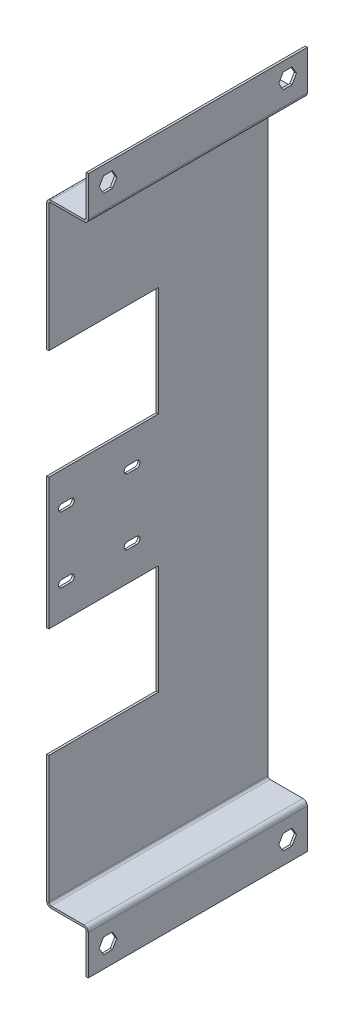
from build123d import *

# Parameters (mm, degrees)
SKETCH1_W                      = 280
SKETCH1_H                      = 100
BOSS_EXTRUDE1_DEPTH            = 1
SKETCH2_W                      = 50
SKETCH2_H                      = 50
CUT_EXTRUDE3_DEPTH             = 149.664050799
CUT_EXTRUDE4_DEPTH             = 149.664050799
EDGE_FLANGE1_STRIP_W           = 6
EDGE_FLANGE1_STRIP_H           = 1
EDGE_FLANGE1_STRIP_CUT_DEPTH   = 100
EDGE_FLANGE1_STRIP_2_W         = 6
EDGE_FLANGE1_STRIP_2_H         = 1
EDGE_FLANGE1_STRIP_CUT_2_DEPTH = 100
EDGE_FLANGE1_DEPTH             = 100
EDGE_FLANGE1_BEND_DEPTH        = 100
EDGE_FLANGE2_STRIP_W           = 6
EDGE_FLANGE2_STRIP_H           = 1
EDGE_FLANGE2_STRIP_CUT_DEPTH   = 100
EDGE_FLANGE2_STRIP_2_W         = 6
EDGE_FLANGE2_STRIP_2_H         = 1
EDGE_FLANGE2_STRIP_CUT_2_DEPTH = 100
EDGE_FLANGE2_DEPTH             = 100
EDGE_FLANGE2_BEND_DEPTH        = 100
CUT_EXTRUDE5_DEPTH             = 168.755774863


# Sheet-metal steps are written as plain solids
with BuildPart() as part:
    # Sketch1 → Boss-Extrude1 (new body)
    with BuildSketch(Plane.YZ):
        Rectangle(SKETCH1_W, SKETCH1_H)
    extrude(amount=BOSS_EXTRUDE1_DEPTH)

    # Sketch2 → Cut-Extrude3 (cut, through all)
    with BuildSketch(Plane.YZ.offset(1)):
        with Locations((-55, 25)):
            Rectangle(SKETCH2_W, SKETCH2_H)
        with Locations((55, 25)):
            Rectangle(SKETCH2_W, SKETCH2_H)
    extrude(amount=-CUT_EXTRUDE3_DEPTH, mode=Mode.SUBTRACT)

    # Sketch3 → Cut-Extrude4 (cut, through all)
    with BuildSketch(Plane.YZ.offset(1)):
        with BuildLine():
            Line((-16.6, 40), (-16.6, 44))
            ThreePointArc((-16.6, 44), (-15, 45.6), (-13.4, 44))
            Line((-13.4, 44), (-13.4, 40))
            ThreePointArc((-13.4, 40), (-15, 38.4), (-16.6, 40))
        make_face()
        with BuildLine():
            Line((13.4, 40), (13.4, 44))
            ThreePointArc((13.4, 44), (15, 45.6), (16.6, 44))
            Line((16.6, 44), (16.6, 40))
            ThreePointArc((16.6, 40), (15, 38.4), (13.4, 40))
        make_face()
        with BuildLine():
            Line((13.4, 10), (13.4, 14))
            ThreePointArc((13.4, 14), (15, 15.6), (16.6, 14))
            Line((16.6, 14), (16.6, 10))
            ThreePointArc((16.6, 10), (15, 8.4), (13.4, 10))
        make_face()
        with BuildLine():
            Line((-16.6, 10), (-16.6, 14))
            ThreePointArc((-16.6, 14), (-15, 15.6), (-13.4, 14))
            Line((-13.4, 14), (-13.4, 10))
            ThreePointArc((-13.4, 10), (-15, 8.4), (-16.6, 10))
        make_face()
    extrude(amount=-CUT_EXTRUDE4_DEPTH, mode=Mode.SUBTRACT)

    # Edge-Flange1 strip (across the edge) → Edge-Flange1 strip cut (cut)
    with BuildSketch(Plane(origin=(1, 140, -50), x_dir=(0, -1, 0), z_dir=(0, 0, 1))):
        with Locations((-1, -0.5)):
            Rectangle(EDGE_FLANGE1_STRIP_W, EDGE_FLANGE1_STRIP_H)
    extrude(amount=EDGE_FLANGE1_STRIP_CUT_DEPTH, mode=Mode.SUBTRACT)

    # Edge-Flange1 strip 2 (across the edge) → Edge-Flange1 strip cut 2 (cut)
    with BuildSketch(Plane(origin=(1, -140, 50), x_dir=(0, 1, 0), z_dir=(0, 0, -1))):
        with Locations((-1, -0.5)):
            Rectangle(EDGE_FLANGE1_STRIP_2_W, EDGE_FLANGE1_STRIP_2_H)
    extrude(amount=EDGE_FLANGE1_STRIP_CUT_2_DEPTH, mode=Mode.SUBTRACT)

    # Edge-Flange1 section (across the edge) → Edge-Flange1 (add)
    with BuildSketch(Plane(origin=(1, 140, -50), x_dir=(0, -1, 0), z_dir=(0, 0, 1))):
        with BuildLine():
            Line((0, 1), (0, 18))
            Line((0, 18), (1, 18))
            Line((1, 18), (1, 1))
            ThreePointArc((1, 1), (1.292893219, 0.292893219), (2, 0))
            Line((2, 0), (2, -1))
            ThreePointArc((2, -1), (0.585786438, -0.414213562), (0, 1))
        make_face()
    extrude(amount=EDGE_FLANGE1_DEPTH)

    # Edge-Flange1 section 2 (across the edge) → Edge-Flange1 bend (add)
    with BuildSketch(Plane(origin=(1, -140, 50), x_dir=(0, 1, 0), z_dir=(0, 0, -1))):
        with BuildLine():
            Line((0, 1), (0, 18))
            Line((0, 18), (1, 18))
            Line((1, 18), (1, 1))
            ThreePointArc((1, 1), (1.292893219, 0.292893219), (2, 0))
            Line((2, 0), (2, -1))
            ThreePointArc((2, -1), (0.585786438, -0.414213562), (0, 1))
        make_face()
    extrude(amount=EDGE_FLANGE1_BEND_DEPTH)

    # Edge-Flange2 strip (across the edge) → Edge-Flange2 strip cut (cut)
    with BuildSketch(Plane(origin=(19, 140, 50), x_dir=(-1, 0, 0), z_dir=(0, 0, -1))):
        with Locations((-1, -0.5)):
            Rectangle(EDGE_FLANGE2_STRIP_W, EDGE_FLANGE2_STRIP_H)
    extrude(amount=EDGE_FLANGE2_STRIP_CUT_DEPTH, mode=Mode.SUBTRACT)

    # Edge-Flange2 strip 2 (across the edge) → Edge-Flange2 strip cut 2 (cut)
    with BuildSketch(Plane(origin=(19, -140, -50), x_dir=(-1, 0, 0), z_dir=(0, 0, 1))):
        with Locations((-1, -0.5)):
            Rectangle(EDGE_FLANGE2_STRIP_2_W, EDGE_FLANGE2_STRIP_2_H)
    extrude(amount=EDGE_FLANGE2_STRIP_CUT_2_DEPTH, mode=Mode.SUBTRACT)

    # Edge-Flange2 section (across the edge) → Edge-Flange2 (add)
    with BuildSketch(Plane(origin=(19, 140, 50), x_dir=(-1, 0, 0), z_dir=(0, 0, -1))):
        with BuildLine():
            Line((0, 1), (0, 19))
            Line((0, 19), (1, 19))
            Line((1, 19), (1, 1))
            ThreePointArc((1, 1), (1.292893219, 0.292893219), (2, 0))
            Line((2, 0), (2, -1))
            ThreePointArc((2, -1), (0.585786438, -0.414213562), (0, 1))
        make_face()
    extrude(amount=EDGE_FLANGE2_DEPTH)

    # Edge-Flange2 section 2 (across the edge) → Edge-Flange2 bend (add)
    with BuildSketch(Plane(origin=(19, -140, -50), x_dir=(-1, 0, 0), z_dir=(0, 0, 1))):
        with BuildLine():
            Line((0, 1), (0, 19))
            Line((0, 19), (1, 19))
            Line((1, 19), (1, 1))
            ThreePointArc((1, 1), (1.292893219, 0.292893219), (2, 0))
            Line((2, 0), (2, -1))
            ThreePointArc((2, -1), (0.585786438, -0.414213562), (0, 1))
        make_face()
    extrude(amount=EDGE_FLANGE2_BEND_DEPTH)

    # Sketch26 → Cut-Extrude5 (cut, through all)
    with BuildSketch(Plane.YZ.offset(19)):
        Polygon((-149.792397295, 45.041451884), (-153.292397295, 43.020725942), (-153.292397295, 38.979274058), (-149.792397295, 36.958548116), (-146.292397295, 38.979274058), (-146.292397295, 43.020725942), align=None)
        Polygon((-149.792397295, -36.958548116), (-153.292397295, -38.979274058), (-153.292397295, -43.020725942), (-149.792397295, -45.041451884), (-146.292397295, -43.020725942), (-146.292397295, -38.979274058), align=None)
        Polygon((147.707602705, -43.020725942), (151.207602705, -45.041451884), (154.707602705, -43.020725942), (154.707602705, -38.979274058), (151.207602705, -36.958548116), (147.707602705, -38.979274058), align=None)
        Polygon((147.707602705, 38.979274058), (151.207602705, 36.958548116), (154.707602705, 38.979274058), (154.707602705, 43.020725942), (151.207602705, 45.041451884), (147.707602705, 43.020725942), align=None)
    extrude(amount=-CUT_EXTRUDE5_DEPTH, mode=Mode.SUBTRACT)


solid = part.part
